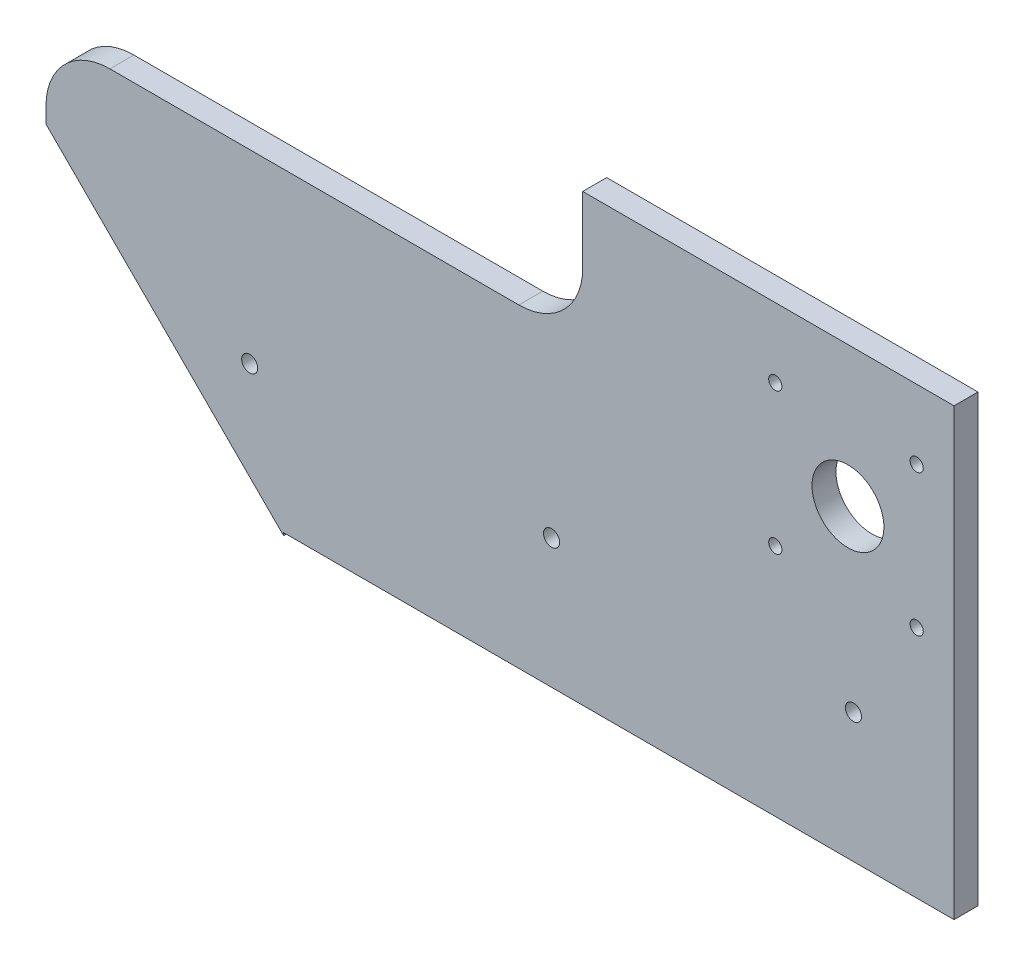
from build123d import *

# Parameters (mm, degrees)
SKETCH1_R                    = 14.2875
BOSS_EXTRUDE1_DEPTH          = 9.525
SKETCH2_W                    = 285.57287806
SKETCH2_H                    = 77.089
CUT_EXTRUDE1_DEPTH           = 267.58430025
SKETCH4_W                    = 213.36
SKETCH4_H                    = 65.465352004
CUT_EXTRUDE2_DEPTH           = 267.58430025
FILLET2_R                    = 25.4
F_6_4_6_4_DIAMETER_HOLE2_D   = 6.4
SKETCH16_W                   = 9.525
SKETCH16_H                   = 0.985363282
CUT_EXTRUDE3_DEPTH           = 390.572219806
SKETCH17_W                   = 147.610011278
SKETCH17_H                   = 12.7
CUT_EXTRUDE4_DEPTH           = 267.045158533
TAP_DRILL_FOR_M6X0_75_TAP1_D = 5.25


with BuildPart() as part:
    # Sketch1 → Boss-Extrude1 (new body)
    with BuildSketch(Plane.XY):
        Polygon((-138.259383474, 48.991487021), (32.210627804, -121.478524257), (222.710627804, -121.478524257), (222.710627804, 146.206839025), (-138.259383474, 146.206839025), align=None)
        with Locations((180.538014078, 76.831975743)):
            Circle(SKETCH1_R, mode=Mode.SUBTRACT)
    extrude(amount=BOSS_EXTRUDE1_DEPTH)

    # Sketch2 → Cut-Extrude1 (cut, through all)
    with BuildSketch(Plane.XY.offset(9.525)):
        with Locations((98.974188774, -82.934024257)):
            Rectangle(SKETCH2_W, SKETCH2_H)
    extrude(amount=-CUT_EXTRUDE1_DEPTH, mode=Mode.SUBTRACT)

    # Sketch4 → Cut-Extrude2 (cut, through all)
    with BuildSketch(Plane.XY.offset(9.525)):
        with Locations((-31.579383474, 113.474163023)):
            Rectangle(SKETCH4_W, SKETCH4_H)
    extrude(amount=-CUT_EXTRUDE2_DEPTH, mode=Mode.SUBTRACT)

    # Fillet2
    fillet2_edges = [part.edges().sort_by_distance(p)[0] for p in [
        (-138.259383474, 80.741487021, 4.7625),
        (75.100616526, 80.741487021, 4.7625),
    ]]
    fillet(fillet2_edges, radius=FILLET2_R)

    # Ø6.4 (6.4) Diameter Hole2 (through all)
    with Locations(Plane(origin=(0, 0, 0), x_dir=(-1, 0, 0), z_dir=(0, 0, -1))):
        with Locations((-182.710627794, 7.042935743), (-62.710627794, 7.042935743), (57.289372206, 7.042935743)):
            Hole(F_6_4_6_4_DIAMETER_HOLE2_D / 2)

    # Sketch16 → Cut-Extrude3 (cut, through all)
    with BuildSketch(Plane(origin=(222.710627804, 0, 0), x_dir=(0, 0, -1), z_dir=(1, 0, 0))):
        with Locations((-4.7625, 145.714157384)):
            Rectangle(SKETCH16_W, SKETCH16_H)
    extrude(amount=-CUT_EXTRUDE3_DEPTH, mode=Mode.SUBTRACT)

    # Sketch17 → Cut-Extrude4 (cut, through all)
    with BuildSketch(Plane(origin=(0, 0, 0), x_dir=(-1, 0, 0), z_dir=(0, 0, -1))):
        with Locations((-148.905622165, 138.871475743)):
            Rectangle(SKETCH17_W, SKETCH17_H)
    extrude(amount=-CUT_EXTRUDE4_DEPTH, mode=Mode.SUBTRACT)

    # Tap Drill for M6x0.75 Tap1 (through all)
    with Locations(Plane.XY.offset(9.525)):
        with Locations((207.854051148, 104.923623608), (151.654051148, 104.923623608), (151.654051148, 48.723623608), (207.854051148, 48.723623608)):
            Hole(TAP_DRILL_FOR_M6X0_75_TAP1_D / 2)


solid = part.part
